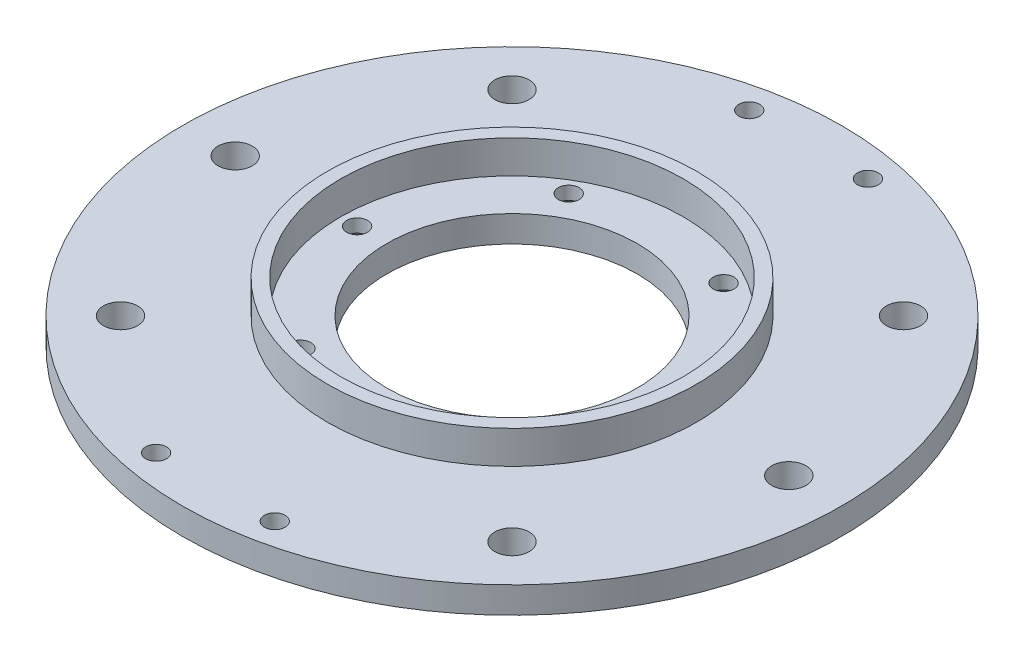
from build123d import *

# Parameters (mm, degrees)
SKETCH_1_R                  = 50
SKETCH_1_R_2                = 19
EXTRUDE_1_DEPTH             = 4
PATTERN_CIRCULAR_1_COUNT    = 6
CHAMFER_1_SIZE              = 2
HOLE_WIZARD_M32_D           = 3.15
PATTERN_LINEAR_1_COUNT      = 2
PATTERN_LINEAR_1_PITCH      = 18
PATTERN_LINEAR_1_COUNT_DIR2 = 2
PATTERN_LINEAR_1_PITCH_DIR2 = 90
HOLE_WIZARD_M52_D           = 5.2
PATTERN_CIRCULAR_3_COUNT    = 2
PATTERN_CIRCULAR_3_ANGLE    = 45
F_3_THE_OTHER_WAY_COUNT     = 2
F_3_THE_OTHER_WAY_ANGLE     = 45
SKETCH_14_R                 = 28
SKETCH_14_R_2               = 26
EXTRUDE_2_DEPTH             = 5


with BuildPart() as part:
    # Эскиз1 → Бобышка-Вытянуть1 (new body)
    with BuildSketch(Plane(origin=(0, 0, 0), x_dir=(1, 0, 0), z_dir=(0, 1, 0))):
        Circle(SKETCH_1_R)
        Circle(SKETCH_1_R_2, mode=Mode.SUBTRACT)
    extrude(amount=EXTRUDE_1_DEPTH)

    # Эскиз3 → Сверло под метчик  спиральное M31 (revolve, cut)
    with BuildSketch(Plane(origin=(23.5, 4, 0), x_dir=(0, 0, 1), z_dir=(1, 0, 0))):
        Polygon((0, 0), (0, 8.946355475), (1.575, 8), (1.575, 0), align=None)
    hole_wizard_m31 = revolve(axis=Axis((23.5, 10.35, 0), (0, -1, 0)), mode=Mode.SUBTRACT)

    # Круговой массив1: Сверло под метчик  спиральное M31 ×6 about axis
    pattern_circular_1_axis = Axis((0, 4, 0), (0, 1, 0))
    for i in range(1, PATTERN_CIRCULAR_1_COUNT):
        add(hole_wizard_m31.rotate(pattern_circular_1_axis, i * 360 / PATTERN_CIRCULAR_1_COUNT), mode=Mode.SUBTRACT)

    # Фаска1
    chamfer_1_edges = [part.edges().sort_by_distance(p)[0] for p in [
        (-10.386009989, 0, 21.139096989),
        (-23.5, 0, 1.575),
        (-13.113990011, 0, -19.564096989),
        (10.386009989, 0, -21.139096989),
        (23.5, 0, -1.575),
        (13.113990011, 0, 19.564096989),
    ]]
    chamfer(chamfer_1_edges, length=CHAMFER_1_SIZE)

    # Сверло под метчик  спиральное M32 (through all)
    with Locations(Plane(origin=(0, 0, 0), x_dir=(-1, 0, 0), z_dir=(0, -1, 0))):
        with Locations((-9, -45)):
            hole_wizard_m32 = Hole(HOLE_WIZARD_M32_D / 2)

    # Линейный массив1: Hole Wizard M32 2 × 2
    with Locations(*[(-i * PATTERN_LINEAR_1_PITCH, 0, -j * PATTERN_LINEAR_1_PITCH_DIR2) for i in range(PATTERN_LINEAR_1_COUNT) for j in range(PATTERN_LINEAR_1_COUNT_DIR2) if (i, j) != (0, 0)]):
        add(hole_wizard_m32, mode=Mode.SUBTRACT)

    # Сверло под метчик  спиральное M52 (through all)
    with Locations(Plane(origin=(0, 0, 0), x_dir=(-1, 0, 0), z_dir=(0, -1, 0))):
        with Locations((42, 0), (-42, 0)):
            hole_wizard_m52 = Hole(HOLE_WIZARD_M52_D / 2)

    # Круговой массив3: Сверло под метчик  спиральное M52 ×2 about axis
    pattern_circular_3_axis = Axis((0, 0, 0), (0, 1, 0))
    for i in range(1, PATTERN_CIRCULAR_3_COUNT):
        add(hole_wizard_m52.rotate(pattern_circular_3_axis, i * PATTERN_CIRCULAR_3_ANGLE / (PATTERN_CIRCULAR_3_COUNT - 1)), mode=Mode.SUBTRACT)

    # 3 the other way: Сверло под метчик  спиральное M52 ×2 about axis
    f_3_the_other_way_axis = Axis((0, 0, 0), (0, -1, 0))
    for i in range(1, F_3_THE_OTHER_WAY_COUNT):
        add(hole_wizard_m52.rotate(f_3_the_other_way_axis, i * F_3_THE_OTHER_WAY_ANGLE / (F_3_THE_OTHER_WAY_COUNT - 1)), mode=Mode.SUBTRACT)

    # Эскиз14 → Бобышка-Вытянуть2 (add)
    with BuildSketch(Plane(origin=(0, 4, 0), x_dir=(1, 0, 0), z_dir=(0, 1, 0))):
        Circle(SKETCH_14_R)
        Circle(SKETCH_14_R_2, mode=Mode.SUBTRACT)
    extrude(amount=EXTRUDE_2_DEPTH)


solid = part.part
